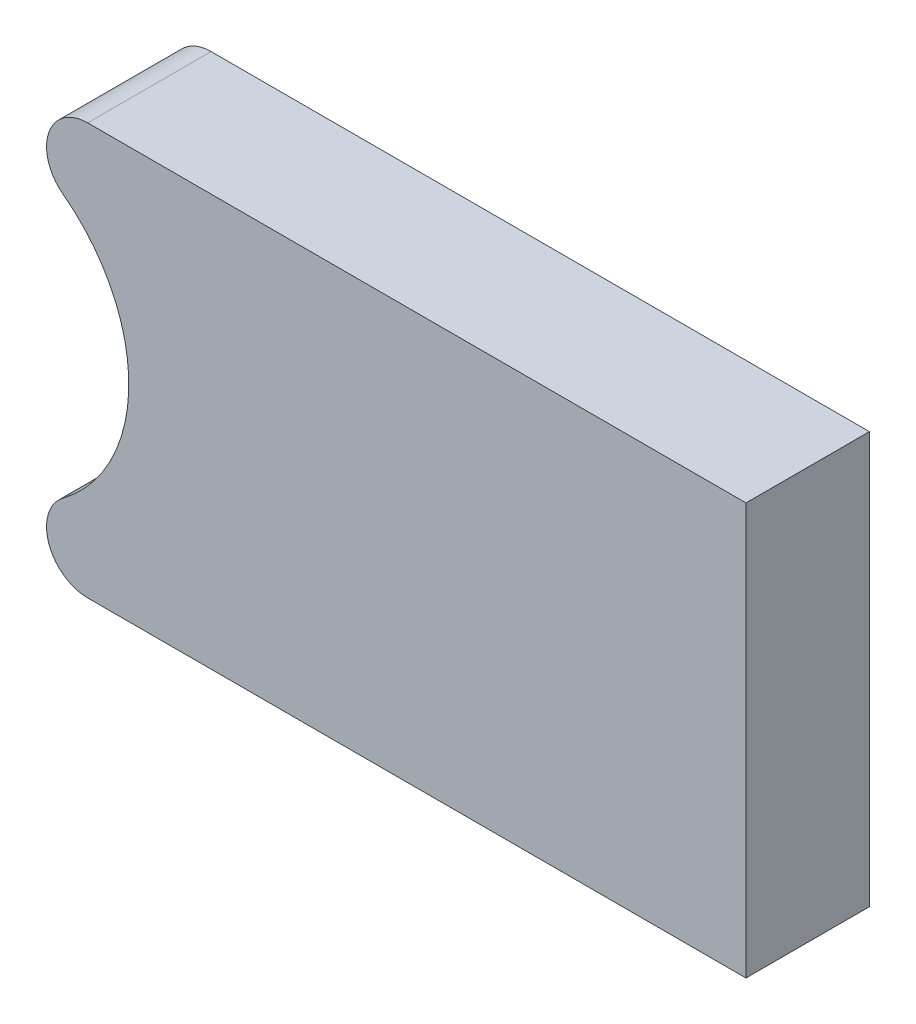
from build123d import *

# Parameters (mm, degrees)
BOSS_EXTRUDE1_DEPTH = 9.525
CAVITY1_START       = -9.525
CAVITY1_DEPTH       = 9.525


# Read off the part's stored shape, not the designer's step: Cavity1
with BuildPart() as part:
    # Sketch1 → Boss-Extrude1 (new body)
    with BuildSketch(Plane.XY):
        Polygon((-114.3, 19.05), (-60.325, 19.05), (-60.325, -19.05), (-114.3, -19.05), (-121.190985561, -19.05), (-111.454402918, 0), (-121.190985561, 19.05), align=None)
    extrude(amount=-BOSS_EXTRUDE1_DEPTH)

    # Cavity1 outline → Cavity1 (cut)
    with BuildSketch(Plane.XY.offset(CAVITY1_START)):
        with BuildLine():
            Line((-111.125, 15.875), (-60.325, 15.875))
            Line((-60.325, 15.875), (-60.325, 19.05))
            Line((-60.325, 19.05), (-121.190985561, 19.05))
            Line((-121.190985561, 19.05), (-111.454402918, 0))
            Line((-111.454402918, 0), (-121.190985561, -19.05))
            Line((-121.190985561, -19.05), (-60.325, -19.05))
            Line((-60.325, -19.05), (-60.325, -15.875))
            Line((-60.325, -15.875), (-111.125, -15.875))
            ThreePointArc((-111.125, -15.875), (-114.137069471, -13.704023157), (-113.03, -10.16))
            ThreePointArc((-113.03, -10.16), (-107.95, 0), (-113.03, 10.16))
            ThreePointArc((-113.03, 10.16), (-114.137069471, 13.704023157), (-111.125, 15.875))
        make_face()
    extrude(amount=CAVITY1_DEPTH, mode=Mode.SUBTRACT)


solid = part.part
